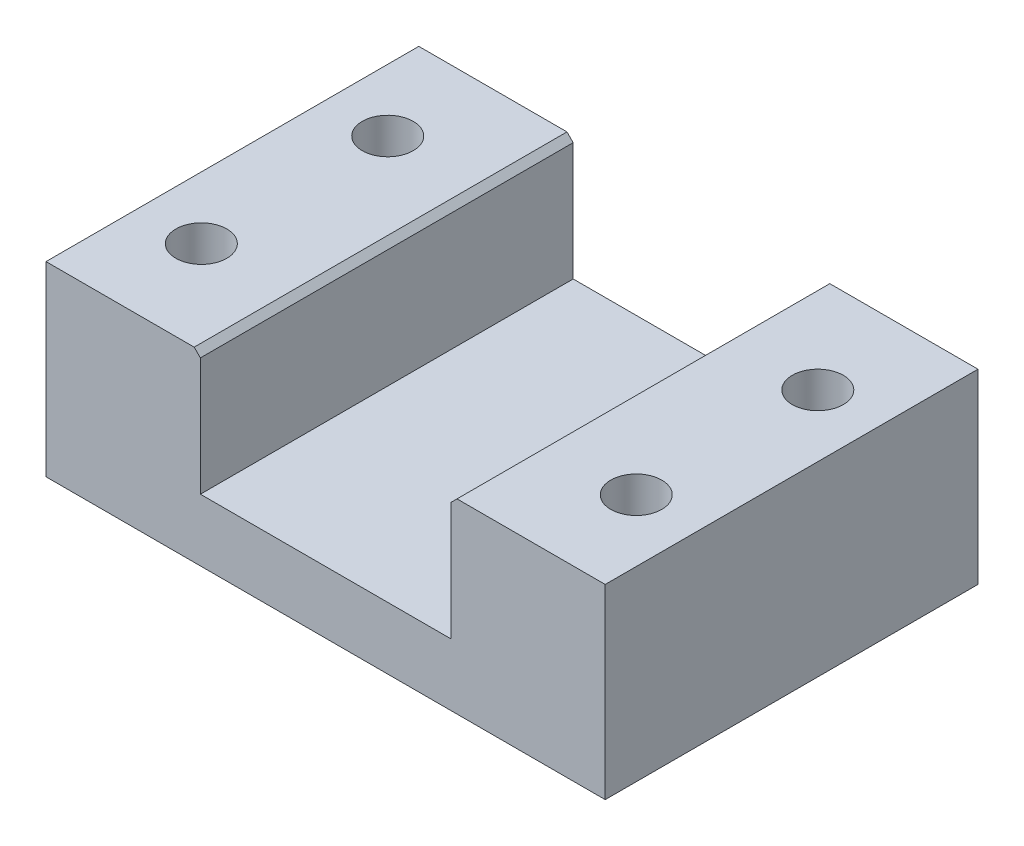
from build123d import *

# Parameters (mm, degrees)
SKETCH1_W           = 90
SKETCH1_H           = 60
BOSS_EXTRUDE1_DEPTH = 30
SKETCH2_W           = 40.3
SKETCH2_H           = 40
CUT_EXTRUDE1_DEPTH  = 81.777472107
SKETCH3_R           = 4.1
CUT_EXTRUDE2_DEPTH  = 62.846584384
SKETCH4_R           = 8
CUT_EXTRUDE3_DEPTH  = 7
CHAMFER1_SIZE       = 1


with BuildPart() as part:
    # Sketch1 → Boss-Extrude1 (new body)
    with BuildSketch(Plane(origin=(0, 0, 0), x_dir=(1, 0, 0), z_dir=(0, 1, 0))):
        Rectangle(SKETCH1_W, SKETCH1_H)
    extrude(amount=BOSS_EXTRUDE1_DEPTH)

    # Sketch2 → Cut-Extrude1 (cut, through all)
    with BuildSketch(Plane.XY.offset(30)):
        with Locations((0, 30)):
            Rectangle(SKETCH2_W, SKETCH2_H)
    extrude(amount=-CUT_EXTRUDE1_DEPTH, mode=Mode.SUBTRACT)

    # Sketch3 → Cut-Extrude2 (cut, through all)
    with BuildSketch(Plane.XZ):
        with Locations((-35, 15)):
            Circle(SKETCH3_R)
        with Locations((-35, -15)):
            Circle(SKETCH3_R)
        with Locations((35, -14.217273236)):
            Circle(SKETCH3_R)
        with Locations((35, 15)):
            Circle(SKETCH3_R)
    extrude(amount=-CUT_EXTRUDE2_DEPTH, mode=Mode.SUBTRACT)

    # Sketch4 → Cut-Extrude3 (cut)
    with BuildSketch(Plane.XZ):
        with Locations((35, 15)):
            Circle(SKETCH4_R)
        with Locations((35, -14.217273236)):
            Circle(SKETCH4_R)
        with Locations((-35, 15)):
            Circle(SKETCH4_R)
        with Locations((-35, -15)):
            Circle(SKETCH4_R)
    extrude(amount=-CUT_EXTRUDE3_DEPTH, mode=Mode.SUBTRACT)

    # Chamfer1
    chamfer1_edges = [part.edges().sort_by_distance(p)[0] for p in [
        (-20.15, 30, 0),
        (20.15, 30, 0),
    ]]
    chamfer(chamfer1_edges, length=CHAMFER1_SIZE)


solid = part.part
